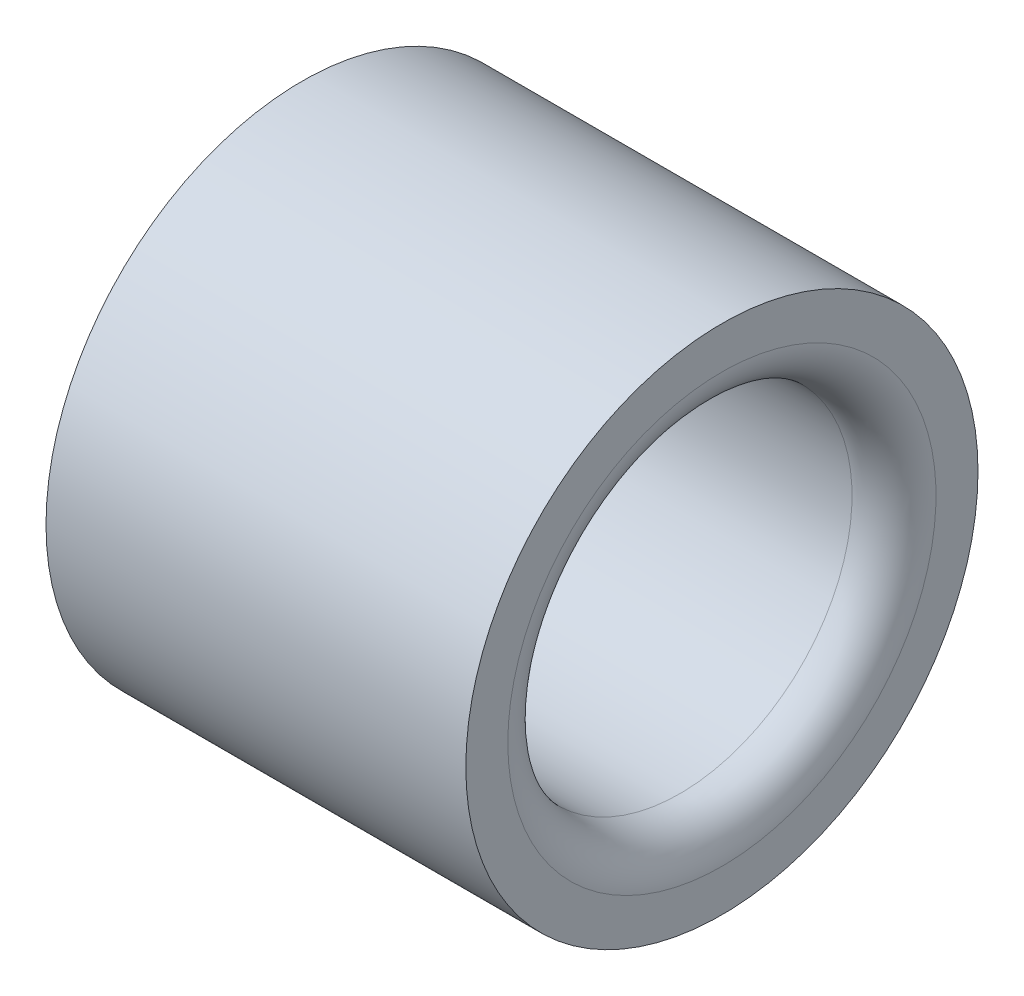
from build123d import *

# Parameters (mm, degrees)
FILLET1_R = 1


with BuildPart() as part:
    # Sketch1 → Revolve1 (revolve)
    with BuildSketch(Plane.XY):
        Polygon((0, 2.6), (1.423611111, 2.6), (1.423611111, 4.1), (10, 4.1), (10, 6.1), (0, 6.1), align=None)
    revolve(axis=Axis((0, 0, 0), (1, 0, 0)))

    # Fillet1
    fillet1_edges = [part.edges().sort_by_distance(p)[0] for p in [
        (10, -4.1, 0),
    ]]
    fillet(fillet1_edges, radius=FILLET1_R)


solid = part.part
